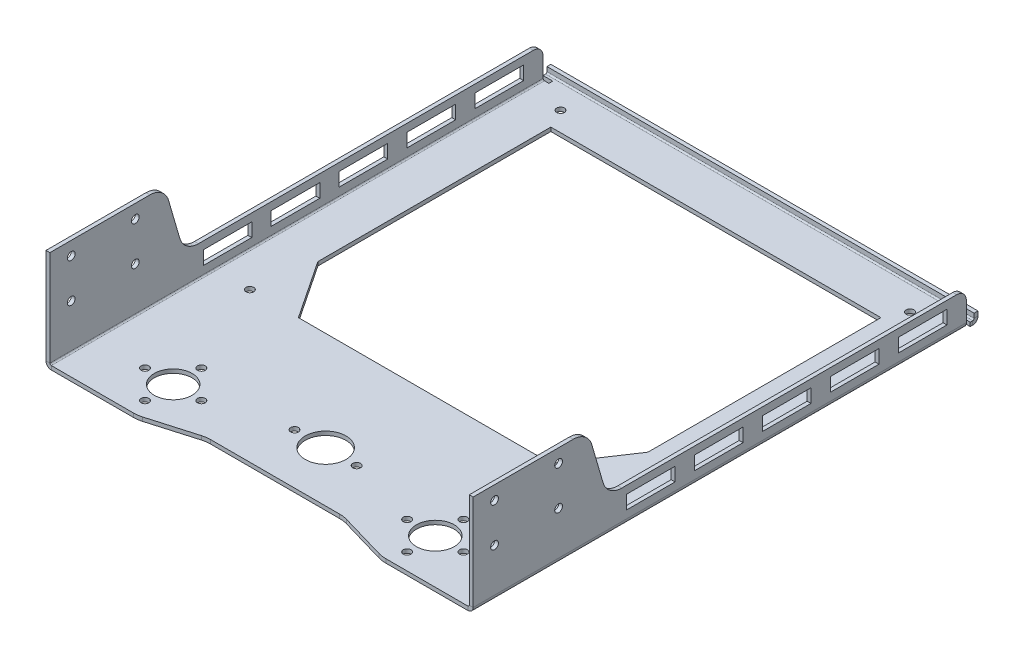
from build123d import *

# Parameters (mm, degrees)
BASE_FLANGE1_START             = -2
BASE_FLANGE1_DEPTH             = 2
EDGE_FLANGE1_STRIP_W           = 9.4732
EDGE_FLANGE1_STRIP_H           = 2
EDGE_FLANGE1_STRIP_CUT_DEPTH   = 254
EDGE_FLANGE1_STRIP_2_W         = 9.4732
EDGE_FLANGE1_STRIP_2_H         = 2
EDGE_FLANGE1_STRIP_CUT_2_DEPTH = 254
EDGE_FLANGE1_DEPTH             = 254
EDGE_FLANGE1_BEND_DEPTH        = 254
EDGE_FLANGE2_STRIP_W           = 9.4732
EDGE_FLANGE2_STRIP_H           = 2
EDGE_FLANGE2_STRIP_CUT_DEPTH   = 220
EDGE_FLANGE2_DEPTH             = 220
SKETCH15_R                     = 2
SKETCH15_R_2                   = 9.75
CUT_EXTRUDE1_DEPTH             = 178.482393493
SKETCH16_W                     = 25
SKETCH16_H                     = 7
SKETCH16_R                     = 2
CUT_EXTRUDE2_DEPTH             = 261.384331326


# Read off the part's stored shape, not the designer's step: Base-Flange1
# Sheet-metal steps are written as plain solids
with BuildPart() as part:
    # Base-Flange1 outline → Base-Flange1 (new body)
    with BuildSketch(Plane(origin=(0, 0, 0), x_dir=(1, 0, 0), z_dir=(0, 1, 0)).offset(BASE_FLANGE1_START)):
        Polygon((105, 126), (110, 126), (110, 130), (-110, 130), (-110, 126), (-105, 126), (-105, 124), (-110, 124), (-110, -130), (110, -130), (110, 124), (105, 124), align=None)
    extrude(amount=BASE_FLANGE1_DEPTH)

    # Edge-Flange1 strip (across the edge) → Edge-Flange1 strip cut (cut)
    with BuildSketch(Plane(origin=(-110, 0, -124), x_dir=(1, 0, 0), z_dir=(0, 0, 1))):
        with Locations((-2, -1)):
            Rectangle(EDGE_FLANGE1_STRIP_W, EDGE_FLANGE1_STRIP_H)
    extrude(amount=EDGE_FLANGE1_STRIP_CUT_DEPTH, mode=Mode.SUBTRACT)

    # Edge-Flange1 strip 2 (across the edge) → Edge-Flange1 strip cut 2 (cut)
    with BuildSketch(Plane(origin=(110, 0, 130), x_dir=(-1, 0, 0), z_dir=(0, 0, -1))):
        with Locations((-2, -1)):
            Rectangle(EDGE_FLANGE1_STRIP_2_W, EDGE_FLANGE1_STRIP_2_H)
    extrude(amount=EDGE_FLANGE1_STRIP_CUT_2_DEPTH, mode=Mode.SUBTRACT)

    # Edge-Flange1 section (across the edge) → Edge-Flange1 (add)
    with BuildSketch(Plane(origin=(-110, 0, -124), x_dir=(1, 0, 0), z_dir=(0, 0, 1))):
        with BuildLine():
            Line((0, 0.7366), (0, 50))
            Line((0, 50), (2, 50))
            Line((2, 50), (2, 0.7366))
            ThreePointArc((2, 0.7366), (2.215745145, 0.215745145), (2.7366, 0))
            Line((2.7366, 0), (2.7366, -2))
            ThreePointArc((2.7366, -2), (0.801531583, -1.198468417), (0, 0.7366))
        make_face()
    extrude(amount=EDGE_FLANGE1_DEPTH)

    # Edge-Flange1 section 2 (across the edge) → Edge-Flange1 bend (add)
    with BuildSketch(Plane(origin=(110, 0, 130), x_dir=(-1, 0, 0), z_dir=(0, 0, -1))):
        with BuildLine():
            Line((0, 0.7366), (0, 50))
            Line((0, 50), (2, 50))
            Line((2, 50), (2, 0.7366))
            ThreePointArc((2, 0.7366), (2.215745145, 0.215745145), (2.7366, 0))
            Line((2.7366, 0), (2.7366, -2))
            ThreePointArc((2.7366, -2), (0.801531583, -1.198468417), (0, 0.7366))
        make_face()
    extrude(amount=EDGE_FLANGE1_BEND_DEPTH)

    # Edge-Flange2 strip (across the edge) → Edge-Flange2 strip cut (cut)
    with BuildSketch(Plane(origin=(110, 0, -130), x_dir=(0, 0, 1), z_dir=(-1, 0, 0))):
        with Locations((-2, -1)):
            Rectangle(EDGE_FLANGE2_STRIP_W, EDGE_FLANGE2_STRIP_H)
    extrude(amount=EDGE_FLANGE2_STRIP_CUT_DEPTH, mode=Mode.SUBTRACT)

    # Edge-Flange2 section (across the edge) → Edge-Flange2 (add)
    with BuildSketch(Plane(origin=(110, 0, -130), x_dir=(0, 0, 1), z_dir=(-1, 0, 0))):
        with BuildLine():
            Line((0, 0.7366), (0, 3))
            Line((0, 3), (2, 3))
            Line((2, 3), (2, 0.7366))
            ThreePointArc((2, 0.7366), (2.215745145, 0.215745145), (2.7366, 0))
            Line((2.7366, 0), (2.7366, -2))
            ThreePointArc((2.7366, -2), (0.801531583, -1.198468417), (0, 0.7366))
        make_face()
    extrude(amount=EDGE_FLANGE2_DEPTH)

    # Sketch15 → Cut-Extrude1 (cut, through all)
    with BuildSketch(Plane(origin=(0, 0, 0), x_dir=(1, 0, 0), z_dir=(0, 1, 0))):
        Polygon((-85, -15), (-85, 105), (85, 105), (85, -15), (65, -45), (-65, -45), align=None)
        with Locations(Location((82, -107, 0), (0, 0, 270))):
            Circle(SKETCH15_R)
        with Locations(Location((67.5, -92.5, 0), (0, 0, 270))):
            Circle(SKETCH15_R)
        with Locations(Location((53, -107, 0), (0, 0, 270))):
            Circle(SKETCH15_R)
        with Locations(Location((67.5, -121.5, 0), (0, 0, 270))):
            Circle(SKETCH15_R)
        with Locations(Location((67.5, -107, 0), (0, 0, 270))):
            Circle(SKETCH15_R_2)
        with BuildLine():
            ThreePointArc((0, -85.5), (-10.5, -96), (0, -106.5))
            Line((0, -106.5), (0, -85.5))
        make_face()
        with BuildLine():
            Line((0, -85.5), (0, -106.5))
            ThreePointArc((0, -106.5), (7.424621202, -103.424621202), (10.5, -96))
            ThreePointArc((10.5, -96), (7.424621202, -88.575378798), (0, -85.5))
        make_face()
        with BuildLine():
            Line((0, -122), (0, -130))
            Line((0, -130), (65, -130))
            ThreePointArc((65, -130), (62.885553403, -129.850222745), (60.81333294, -129.403882079))
            Line((60.81333294, -129.403882079), (37.391782876, -122.596117921))
            ThreePointArc((37.391782876, -122.596117921), (35.319562413, -122.149777255), (33.205115817, -122))
            Line((33.205115817, -122), (0, -122))
        make_face()
        with BuildLine():
            Line((-65, -130), (0, -130))
            Line((0, -130), (0, -122))
            Line((0, -122), (-33.205115817, -122))
            ThreePointArc((-33.205115817, -122), (-35.319562413, -122.149777255), (-37.391782876, -122.596117921))
            Line((-37.391782876, -122.596117921), (-60.81333294, -129.403882079))
            ThreePointArc((-60.81333294, -129.403882079), (-62.885553403, -129.850222745), (-65, -130))
        make_face()
        with Locations(Location((16, -96, 0), (0, 0, 270))):
            Circle(SKETCH15_R)
        with Locations(Location((-16, -96, 0), (0, 0, 270))):
            Circle(SKETCH15_R)
        with Locations(Location((-67.5, -107, 0), (0, 0, 270))):
            Circle(SKETCH15_R_2)
        with Locations(Location((-53, -107, 0), (0, 0, 270))):
            Circle(SKETCH15_R)
        with Locations(Location((-67.5, -92.5, 0), (0, 0, 270))):
            Circle(SKETCH15_R)
        with Locations(Location((-67.5, -121.5, 0), (0, 0, 270))):
            Circle(SKETCH15_R)
        with Locations(Location((-82, -107, 0), (0, 0, 270))):
            Circle(SKETCH15_R)
        with Locations(Location((-90, -45, 0), (0, 0, 270))):
            Circle(SKETCH15_R)
        with Locations(Location((90, 115, 0), (0, 0, 90))):
            Circle(SKETCH15_R)
        with Locations(Location((90, -45, 0), (0, 0, 90))):
            Circle(SKETCH15_R)
        with Locations(Location((-90, 115, 0), (0, 0, 270))):
            Circle(SKETCH15_R)
    extrude(amount=-CUT_EXTRUDE1_DEPTH, mode=Mode.SUBTRACT)

    # Sketch16 → Cut-Extrude2 (cut, through all)
    with BuildSketch(Plane.ZY.offset(110)):
        with BuildLine():
            ThreePointArc((-124, 10.7366), (-122.535533906, 14.272133906), (-119, 15.7366))
            Line((-119, 15.7366), (53.501367481, 15.7366))
            ThreePointArc((53.501367481, 15.7366), (59.500667262, 17.736074884), (63.100877196, 22.934919573))
            Line((63.100877196, 22.934919573), (68.899122804, 42.801680427))
            ThreePointArc((68.899122804, 42.801680427), (72.499332738, 48.000525116), (78.498632519, 50))
            Line((78.498632519, 50), (-124, 50))
            Line((-124, 50), (-124, 10.7366))
        make_face()
        with Locations((38.5, 8.2366)):
            Rectangle(SKETCH16_W, SKETCH16_H)
        with Locations((3.5, 8.2366)):
            Rectangle(SKETCH16_W, SKETCH16_H)
        with Locations((-31.5, 8.2366)):
            Rectangle(SKETCH16_W, SKETCH16_H)
        with Locations((-66.5, 8.2366)):
            Rectangle(SKETCH16_W, SKETCH16_H)
        with Locations((-101.5, 8.2366)):
            Rectangle(SKETCH16_W, SKETCH16_H)
        with Locations(Location((86, 43, 0), (0, 0, 270))):
            Circle(SKETCH16_R)
        with Locations(Location((86, 23, 0), (0, 0, 270))):
            Circle(SKETCH16_R)
        with Locations(Location((119, 43, 0), (0, 0, 270))):
            Circle(SKETCH16_R)
        with Locations(Location((119, 23, 0), (0, 0, 270))):
            Circle(SKETCH16_R)
    extrude(amount=-CUT_EXTRUDE2_DEPTH, mode=Mode.SUBTRACT)


solid = part.part
